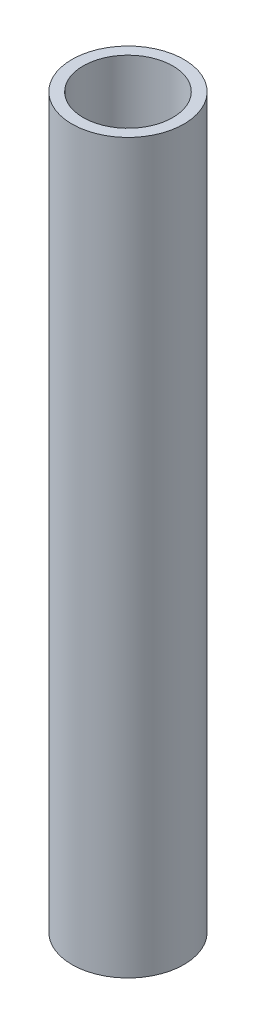
from build123d import *

# Parameters (mm, degrees)
SKETCH1_R           = 10
SKETCH1_R_2         = 8
BOSS_EXTRUDE1_DEPTH = 130


with BuildPart() as part:
    # Sketch1 → Boss-Extrude1 (new body)
    with BuildSketch(Plane(origin=(0, 0, 0), x_dir=(1, 0, 0), z_dir=(0, 1, 0))):
        Circle(SKETCH1_R)
        Circle(SKETCH1_R_2, mode=Mode.SUBTRACT)
    extrude(amount=BOSS_EXTRUDE1_DEPTH)


solid = part.part
